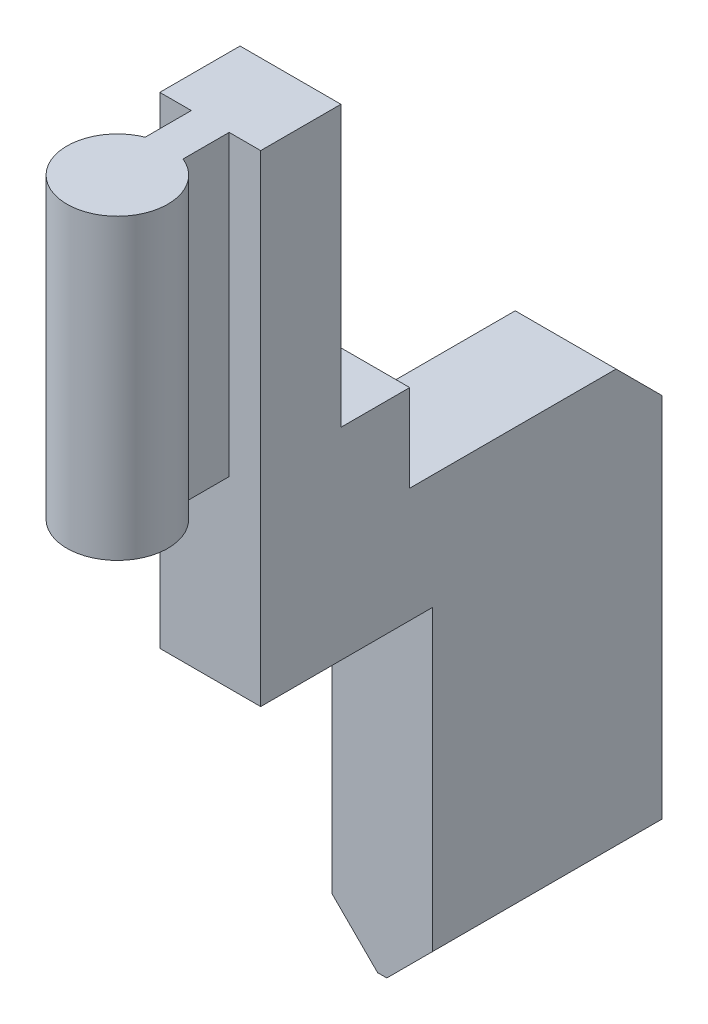
from build123d import *

# Parameters (mm, degrees)
SZKIC1_W                    = 4.4
SZKIC1_H                    = 21
DODANIE_WYCI_GNI_CIE1_DEPTH = 6.5
DODANIE_WYCI_GNI_CIE2_DEPTH = 13
SKETCH1_W                   = 4.4
SKETCH1_H                   = 5
BOSS_EXTRUDE1_DEPTH         = 11
SKETCH3_W                   = 4.4
SKETCH3_H                   = 10
BOSS_EXTRUDE3_DEPTH         = 15
CHAMFER1_SIZE               = 2
SKETCH5_W                   = 4.4
SKETCH5_H                   = 3
CUT_EXTRUDE1_DEPTH          = 12.2


with BuildPart() as part:
    # Szkic1 → Dodanie-wyciągnięcie1 (new body)
    with BuildSketch(Plane.XY):
        Rectangle(SZKIC1_W, SZKIC1_H)
    extrude(amount=DODANIE_WYCI_GNI_CIE1_DEPTH)

    # Szkic3 → Dodanie-wyciągnięcie2 (add)
    with BuildSketch(Plane(origin=(0, 10.5, 0), x_dir=(1, 0, 0), z_dir=(0, 1, 0))):
        with BuildLine():
            Line((0.825, -8.510545416), (0.825, -6.5))
            Line((0.825, -6.5), (-0.825, -6.5))
            Line((-0.825, -6.5), (-0.825, -8.510545416))
            ThreePointArc((-0.825, -8.510545416), (0, -12.75), (0.825, -8.510545416))
        make_face()
    extrude(amount=-DODANIE_WYCI_GNI_CIE2_DEPTH)

    # Sketch1 → Boss-Extrude1 (add)
    with BuildSketch(Plane(origin=(0, 0, 0), x_dir=(-1, 0, 0), z_dir=(0, 0, -1))):
        with Locations((0, -8)):
            Rectangle(SKETCH1_W, SKETCH1_H)
    extrude(amount=BOSS_EXTRUDE1_DEPTH)

    # Sketch3 → Boss-Extrude3 (add)
    with BuildSketch(Plane.XZ.offset(10.5)):
        with Locations((0, -6)):
            Rectangle(SKETCH3_W, SKETCH3_H)
    extrude(amount=BOSS_EXTRUDE3_DEPTH)

    # Chamfer1
    chamfer1_edges = [part.edges().sort_by_distance(p)[0] for p in [
        (2.2, -25.5, -6),
        (-2.2, -25.5, -6),
        (0, -5.5, -11),
    ]]
    chamfer(chamfer1_edges, length=CHAMFER1_SIZE)

    # Sketch5 → Cut-Extrude1 (cut)
    with BuildSketch(Plane(origin=(0, 10.5, 0), x_dir=(1, 0, 0), z_dir=(0, 1, 0))):
        with Locations((0, -1.5)):
            Rectangle(SKETCH5_W, SKETCH5_H)
    extrude(amount=-CUT_EXTRUDE1_DEPTH, mode=Mode.SUBTRACT)


solid = part.part
